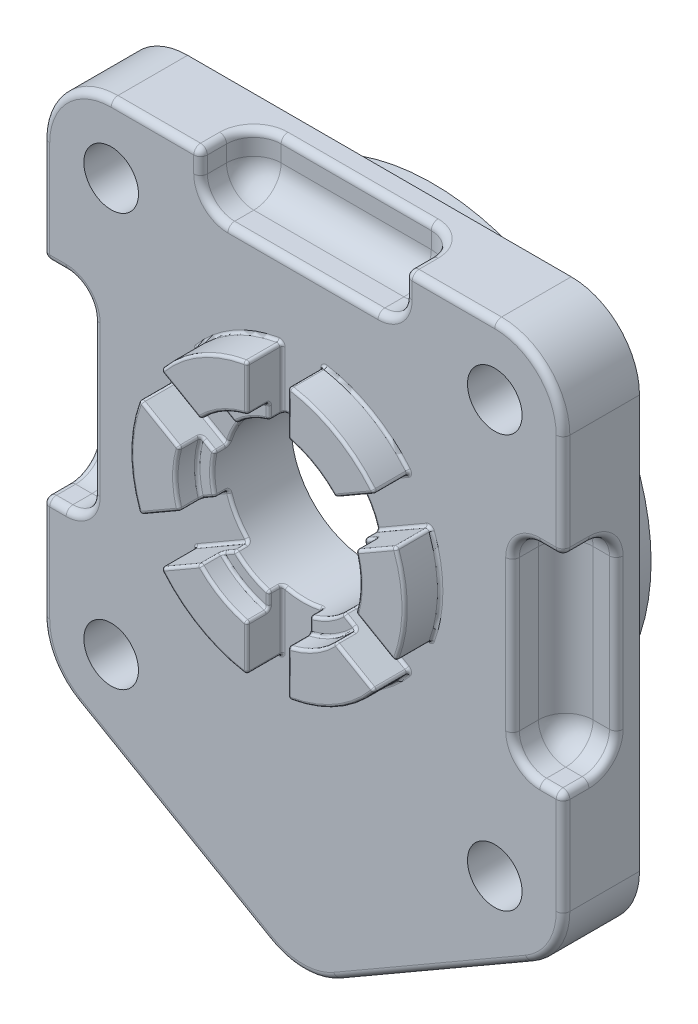
from build123d import *

# Parameters (mm, degrees)
SKETCH1_R           = 2.54
BOSS_EXTRUDE1_DEPTH = 7.112
SKETCH2_R           = 20.32
BOSS_EXTRUDE2_DEPTH = 4.953
SKETCH3_R           = 17.907
SKETCH3_R_2         = 13.335
CUT_EXTRUDE1_DEPTH  = 8.636
SKETCH3_3_R         = 13.335
SKETCH3_3_R_2       = 11.1125
CUT_EXTRUDE2_DEPTH  = 7.493
SKETCH3_4_R         = 7.1755
CUT_EXTRUDE3_DEPTH  = 70.485018263
SKETCH3_5_R         = 11.1125
SKETCH3_5_R_2       = 7.1755
CUT_EXTRUDE4_DEPTH  = 5.969
CHAMFER1_SIZE       = 1.27
CHAMFER1_SIZE2      = 1.103994157
CHAMFER2_SIZE       = 0.508
CHAMFER2_SIZE2      = 1.475339126
SKETCH4_R           = 12.7635
SKETCH4_R_2         = 8.5725
BOSS_EXTRUDE3_DEPTH = 3.302
SKETCH4_5_R         = 8.5725
SKETCH4_5_R_2       = 7.1755
BOSS_EXTRUDE5_DEPTH = 1.27
CUT_EXTRUDE5_DEPTH  = 3.302
FILLET1_R           = 0.254
CUT_EXTRUDE6_DEPTH  = 4.953
FILLET2_R           = 2.54
FILLET3_R           = 0.635
SKETCH8_R           = 0.889
CUT_EXTRUDE7_DEPTH  = 6.35


with BuildPart() as part:
    # Sketch1 → Boss-Extrude1 (new body)
    with BuildSketch(Plane.XY):
        with BuildLine():
            Line((48.387, 3.666174209), (48.387, 42.037))
            ThreePointArc((48.387, 42.037), (46.527128061, 46.527128061), (42.037, 48.387))
            Line((42.037, 48.387), (6.35, 48.387))
            ThreePointArc((6.35, 48.387), (1.859871939, 46.527128061), (0, 42.037))
            Line((0, 42.037), (0, 3.666174209))
            ThreePointArc((0, 3.666174209), (0.850738686, 0.491174209), (3.175, -1.833087105))
            Line((3.175, -1.833087105), (21.0185, -12.135036633))
            ThreePointArc((21.0185, -12.135036633), (24.1935, -12.985775319), (27.3685, -12.135036633))
            Line((27.3685, -12.135036633), (45.212, -1.833087105))
            ThreePointArc((45.212, -1.833087105), (47.536261314, 0.491174209), (48.387, 3.666174209))
        make_face()
        with Locations((6.35, 42.037)):
            Circle(SKETCH1_R, mode=Mode.SUBTRACT)
        with Locations((42.037, 42.037)):
            Circle(SKETCH1_R, mode=Mode.SUBTRACT)
        with Locations((42.037, 3.666174209)):
            Circle(SKETCH1_R, mode=Mode.SUBTRACT)
        with Locations((6.35, 3.666174209)):
            Circle(SKETCH1_R, mode=Mode.SUBTRACT)
    extrude(amount=BOSS_EXTRUDE1_DEPTH)

    # Sketch2 → Boss-Extrude2 (add)
    with BuildSketch(Plane.XY):
        with Locations((24.1935, 24.1935)):
            Circle(SKETCH2_R)
    extrude(amount=-BOSS_EXTRUDE2_DEPTH)

    # Sketch3 → Cut-Extrude1 (cut)
    with BuildSketch(Plane.XY.offset(-4.953)):
        with Locations((24.1935, 24.1935)):
            Circle(SKETCH3_R)
        with Locations((24.1935, 24.1935)):
            Circle(SKETCH3_R_2, mode=Mode.SUBTRACT)
    extrude(amount=CUT_EXTRUDE1_DEPTH, mode=Mode.SUBTRACT)

    # Sketch3<3> → Cut-Extrude2 (cut)
    with BuildSketch(Plane.XY.offset(-4.953)):
        with Locations((24.1935, 24.1935)):
            Circle(SKETCH3_3_R)
        with Locations((24.1935, 24.1935)):
            Circle(SKETCH3_3_R_2, mode=Mode.SUBTRACT)
    extrude(amount=CUT_EXTRUDE2_DEPTH, mode=Mode.SUBTRACT)

    # Sketch3<4> → Cut-Extrude3 (cut, through all)
    with BuildSketch(Plane.XY.offset(-4.953)):
        with Locations(Location((24.1935, 24.1935, 0), (0, 0, 180))):
            Circle(SKETCH3_4_R)
    extrude(amount=CUT_EXTRUDE3_DEPTH, mode=Mode.SUBTRACT)

    # Sketch3<5> → Cut-Extrude4 (cut)
    with BuildSketch(Plane.XY.offset(-4.953)):
        with Locations((24.1935, 24.1935)):
            Circle(SKETCH3_5_R)
        with Locations(Location((24.1935, 24.1935, 0), (0, 0, 180))):
            Circle(SKETCH3_5_R_2, mode=Mode.SUBTRACT)
    extrude(amount=CUT_EXTRUDE4_DEPTH, mode=Mode.SUBTRACT)

    # Chamfer1
    chamfer1_edges = [part.edges().sort_by_distance(p)[0] for p in [
        (10.8585, 24.1935, 2.54),
    ]]
    chamfer1_side = [part.faces().sort_by_distance(p)[0] for p in [
        (11.235670757, 24.1935, 2.54),
    ]]
    chamfer(chamfer1_edges, length=CHAMFER1_SIZE, length2=CHAMFER1_SIZE2, reference=chamfer1_side[0])

    # Chamfer2
    chamfer2_edges = [part.edges().sort_by_distance(p)[0] for p in [
        (13.081, 24.1935, 1.016),
    ]]
    chamfer2_side = [part.faces().sort_by_distance(p)[0] for p in [
        (13.395308964, 24.1935, 1.016),
    ]]
    chamfer(chamfer2_edges, length=CHAMFER2_SIZE, length2=CHAMFER2_SIZE2, reference=chamfer2_side[0])

    # Sketch4 → Boss-Extrude3 (add)
    with BuildSketch(Plane.XY.offset(7.112)):
        with Locations(Location((24.1935, 24.1935, 0), (0, 0, 180))):
            Circle(SKETCH4_R)
        with Locations(Location((24.1935, 24.1935, 0), (0, 0, 180))):
            Circle(SKETCH4_R_2, mode=Mode.SUBTRACT)
    extrude(amount=BOSS_EXTRUDE3_DEPTH)

    # Sketch4<5> → Boss-Extrude5 (add)
    with BuildSketch(Plane.XY.offset(7.112)):
        with Locations(Location((24.1935, 24.1935, 0), (0, 0, 180))):
            Circle(SKETCH4_5_R)
        with Locations(Location((24.1935, 24.1935, 0), (0, 0, 180))):
            Circle(SKETCH4_5_R_2, mode=Mode.SUBTRACT)
    extrude(amount=BOSS_EXTRUDE5_DEPTH)

    # Sketch5 → Cut-Extrude5 (cut)
    with BuildSketch(Plane.XY.offset(10.414)):
        Polygon((26.0985, 27.491324738), (26.0985, 25.295084314), (28.0065, 24.1935), (39.445579416, 30.79785558), (37.540579416, 34.097412369), align=None)
        Polygon((28.0065, 24.1935), (26.0985, 23.091915686), (26.0985, 20.895675262), (37.540579416, 14.289587631), (39.445579416, 17.58914442), align=None)
        Polygon((24.1965, 26.393204526), (26.0985, 27.491324738), (26.0985, 40.7035), (22.2885, 40.7035), (22.2885, 27.494788839), align=None)
        Polygon((26.0985, 7.6835), (26.0985, 20.895675262), (24.1965, 21.993795474), (22.2885, 20.892211161), (22.2885, 7.6835), align=None)
        Polygon((22.2885, 25.291620212), (22.2885, 27.494788839), (10.849420584, 34.09914442), (8.944420584, 30.799587631), (20.3865, 24.1935), align=None)
        Polygon((10.849420584, 14.28785558), (22.2885, 20.892211161), (22.2885, 23.095379788), (20.3865, 24.1935), (8.944420584, 17.587412369), align=None)
    extrude(amount=-CUT_EXTRUDE5_DEPTH, mode=Mode.SUBTRACT)

    # Fillet1
    fillet1_edges = [part.edges().sort_by_distance(p)[0] for p in [
        (24.1935, 31.369, 7.112),
        (26.0985, 34.68284436, 10.414),
        (22.2885, 34.68284436, 10.414),
        (22.2885, 36.814035141, 8.763),
        (22.2885, 33.962769423, 7.112),
        (22.2885, 31.111503704, 7.747),
        (22.2885, 32.551653579, 9.398),
        (26.0985, 33.962769423, 7.112),
        (26.0985, 36.814035141, 8.763),
        (26.0985, 31.111503704, 7.747),
        (26.0985, 32.551653579, 9.398),
        (28.480416145, 31.617118135, 8.382),
        (27.781923654, 30.407276302, 8.382),
        (29.856846899, 29.661207331, 8.382),
        (31.761193106, 26.361273076, 8.382),
        (30.57590686, 35.246635977, 10.414),
        (28.480416145, 31.617118135, 10.414),
        (30.57590686, 35.246635977, 7.112),
        (30.408443055, 27.779902526, 7.112),
        (34.230542504, 27.786952615, 10.414),
        (32.326034665, 31.086793553, 10.414),
        (33.606908483, 27.426897345, 7.112),
        (36.07625788, 28.852576884, 8.763),
        (31.137559086, 26.001217806, 7.747),
        (32.384827127, 26.721328346, 9.398),
        (34.171650045, 32.152360089, 8.763),
        (31.70246228, 30.726773868, 7.112),
        (29.233274514, 29.301187647, 7.747),
        (30.480419284, 30.021227016, 9.398),
        (31.369, 24.1935, 8.382),
        (30.408443055, 20.607097474, 7.112),
        (29.233274514, 19.085812353, 7.747),
        (31.137559086, 22.385782194, 7.747),
        (36.957, 24.1935, 7.112),
        (32.766, 24.1935, 8.382),
        (32.766, 24.1935, 10.414),
        (36.957, 24.1935, 10.414),
        (32.326034665, 17.300206447, 10.414),
        (34.230542504, 20.600047385, 10.414),
        (36.07625788, 19.534423116, 8.763),
        (33.606908483, 20.960102655, 7.112),
        (32.384827127, 21.665671654, 9.398),
        (31.761193106, 22.025726924, 8.382),
        (31.70246228, 17.660226132, 7.112),
        (34.171650045, 16.234639911, 8.763),
        (29.856846899, 18.725792669, 8.382),
        (30.480419284, 18.365772984, 9.398),
        (27.781923654, 17.979723698, 8.382),
        (24.1935, 17.018, 7.112),
        (22.2885, 17.275496296, 7.747),
        (26.0985, 17.275496296, 7.747),
        (30.57590686, 13.140364023, 7.112),
        (28.480416145, 16.769881865, 8.382),
        (28.480416145, 16.769881865, 10.414),
        (30.57590686, 13.140364023, 10.414),
        (22.2885, 13.70415564, 10.414),
        (26.0985, 13.70415564, 10.414),
        (26.0985, 11.572964859, 8.763),
        (26.0985, 14.424230577, 7.112),
        (26.0985, 15.835346421, 9.398),
        (26.0985, 16.555421358, 8.382),
        (22.2885, 14.424230577, 7.112),
        (22.2885, 11.572964859, 8.763),
        (22.2885, 16.555421358, 8.382),
        (22.2885, 15.835346421, 9.398),
        (20.606423736, 17.978945782, 8.382),
        (17.980112777, 20.604402694, 7.112),
        (17.250225486, 22.382771065, 7.747),
        (19.155940914, 19.083627329, 7.747),
        (17.812406894, 13.139605527, 7.112),
        (19.907916207, 16.769112631, 8.382),
        (19.907916207, 16.769112631, 10.414),
        (17.812406894, 13.139605527, 10.414),
        (14.157465335, 20.59716516, 10.414),
        (16.062957496, 17.29789252, 10.414),
        (14.21724212, 16.232268251, 8.763),
        (16.686591517, 17.65794779, 7.112),
        (17.908672873, 18.36351679, 9.398),
        (18.532306894, 18.72357206, 8.382),
        (14.78103772, 20.957184844, 7.112),
        (12.311849955, 19.531598623, 8.763),
        (16.626653101, 22.022751381, 8.382),
        (16.003080716, 21.662731697, 9.398),
        (17.076293156, 25.106279814, 8.382),
        (17.980112777, 27.782597306, 7.112),
        (19.155940914, 29.303372671, 7.747),
        (17.250225486, 26.004228935, 7.747),
        (11.43, 24.1935, 7.112),
        (15.621, 24.1935, 8.382),
        (15.621, 24.1935, 10.414),
        (11.43, 24.1935, 10.414),
        (16.062957496, 31.08910748, 10.414),
        (14.157465335, 27.78983484, 10.414),
        (12.311849955, 28.855401377, 8.763),
        (14.78103772, 27.429815156, 7.112),
        (16.003080716, 26.724268303, 9.398),
        (16.626653101, 26.364248619, 8.382),
        (16.686591517, 30.72905221, 7.112),
        (14.21724212, 32.154731749, 8.763),
        (18.532306894, 29.66342794, 8.382),
        (17.908672873, 30.02348321, 9.398),
        (20.606423736, 30.408054218, 8.382),
        (19.907916207, 31.617887369, 8.382),
        (26.0985, 31.831578642, 8.382),
        (22.2885, 31.831578642, 8.382),
        (19.907916207, 31.617887369, 10.414),
        (17.812406894, 35.247394473, 10.414),
        (17.812406894, 35.247394473, 7.112),
    ]]
    fillet(fillet1_edges, radius=FILLET1_R)

    # Sketch6 → Cut-Extrude6 (cut)
    with BuildSketch(Plane.XY.offset(7.112)):
        with BuildLine():
            Line((0, 13.326587105), (0, 32.376587105))
            Line((0, 32.376587105), (2.159, 32.376587105))
            ThreePointArc((2.159, 32.376587105), (3.955051224, 31.632638329), (4.699, 29.836587105))
            Line((4.699, 29.836587105), (4.699, 15.866587105))
            ThreePointArc((4.699, 15.866587105), (3.955051224, 14.07053588), (2.159, 13.326587105))
            Line((2.159, 13.326587105), (0, 13.326587105))
        make_face()
        with BuildLine():
            Line((48.387, 13.326587105), (48.387, 32.376587105))
            Line((48.387, 32.376587105), (46.228, 32.376587105))
            ThreePointArc((46.228, 32.376587105), (44.431948776, 31.632638329), (43.688, 29.836587105))
            Line((43.688, 29.836587105), (43.688, 15.866587105))
            ThreePointArc((43.688, 15.866587105), (44.431948776, 14.07053588), (46.228, 13.326587105))
            Line((46.228, 13.326587105), (48.387, 13.326587105))
        make_face()
        with BuildLine():
            Line((14.6685, 48.387), (33.7185, 48.387))
            Line((33.7185, 48.387), (33.7185, 46.228))
            ThreePointArc((33.7185, 46.228), (32.974551224, 44.431948776), (31.1785, 43.688))
            Line((31.1785, 43.688), (17.2085, 43.688))
            ThreePointArc((17.2085, 43.688), (15.412448776, 44.431948776), (14.6685, 46.228))
            Line((14.6685, 46.228), (14.6685, 48.387))
        make_face()
    extrude(amount=-CUT_EXTRUDE6_DEPTH, mode=Mode.SUBTRACT)

    # Fillet2
    fillet2_edges = [part.edges().sort_by_distance(p)[0] for p in [
        (3.955051224, 14.07053588, 2.159),
        (1.0795, 13.326587105, 2.159),
        (1.0795, 32.376587105, 2.159),
        (3.955051224, 31.632638329, 2.159),
        (4.699, 22.851587105, 2.159),
        (47.3075, 13.326587105, 2.159),
        (44.431948776, 14.07053588, 2.159),
        (43.688, 22.851587105, 2.159),
        (44.431948776, 31.632638329, 2.159),
        (47.3075, 32.376587105, 2.159),
        (33.7185, 47.3075, 2.159),
        (32.974551224, 44.431948776, 2.159),
        (24.1935, 43.688, 2.159),
        (15.412448776, 44.431948776, 2.159),
        (14.6685, 47.3075, 2.159),
    ]]
    fillet(fillet2_edges, radius=FILLET2_R)

    # Fillet3
    fillet3_edges = [part.edges().sort_by_distance(p)[0] for p in [
        (24.1935, -12.985775319, 7.112),
        (36.29025, -6.984061869, 7.112),
        (47.536261314, 0.491174209, 7.112),
        (48.387, 8.496380657, 7.112),
        (46.527128061, 46.527128061, 7.112),
        (37.87775, 48.387, 7.112),
        (1.859871939, 46.527128061, 7.112),
        (0, 37.206793552, 7.112),
        (0.850738686, 0.491174209, 7.112),
        (0, 8.496380657, 7.112),
        (3.955051224, 14.07053588, 7.112),
        (4.699, 22.851587105, 7.112),
        (3.955051224, 31.632638329, 7.112),
        (1.0795, 32.376587105, 7.112),
        (1.0795, 13.326587105, 7.112),
        (48.387, 37.206793552, 7.112),
        (47.3075, 13.326587105, 7.112),
        (47.3075, 32.376587105, 7.112),
        (44.431948776, 31.632638329, 7.112),
        (43.688, 22.851587105, 7.112),
        (44.431948776, 14.07053588, 7.112),
        (12.09675, -6.984061869, 7.112),
        (10.50925, 48.387, 7.112),
        (33.7185, 47.3075, 7.112),
        (14.6685, 47.3075, 7.112),
        (15.412448776, 44.431948776, 7.112),
        (24.1935, 43.688, 7.112),
        (32.974551224, 44.431948776, 7.112),
        (24.1935, 48.387, 2.159),
        (14.6685, 48.387, 5.9055),
        (33.7185, 48.387, 5.9055),
        (48.387, 22.851587105, 2.159),
        (48.387, 32.376587105, 5.9055),
        (48.387, 13.326587105, 5.9055),
        (0, 22.851587105, 2.159),
        (0, 13.326587105, 5.9055),
        (0, 32.376587105, 5.9055),
        (15.412448776, 48.387, 2.902948776),
        (32.974551224, 48.387, 2.902948776),
        (48.387, 31.632638329, 2.902948776),
        (48.387, 14.07053588, 2.902948776),
        (0, 14.07053588, 2.902948776),
        (0, 31.632638329, 2.902948776),
    ]]
    fillet(fillet3_edges, radius=FILLET3_R)

    # Sketch8 → Cut-Extrude7 (cut, along a direction that is not the sketch's normal)
    with BuildSketch(Plane.XY):
        with Locations((24.1935, -6.635775319)):
            Circle(SKETCH8_R)
    extrude(amount=CUT_EXTRUDE7_DEPTH, dir=(0, 0.9732385173884462, 0.22979727646675682), mode=Mode.SUBTRACT)


solid = part.part
